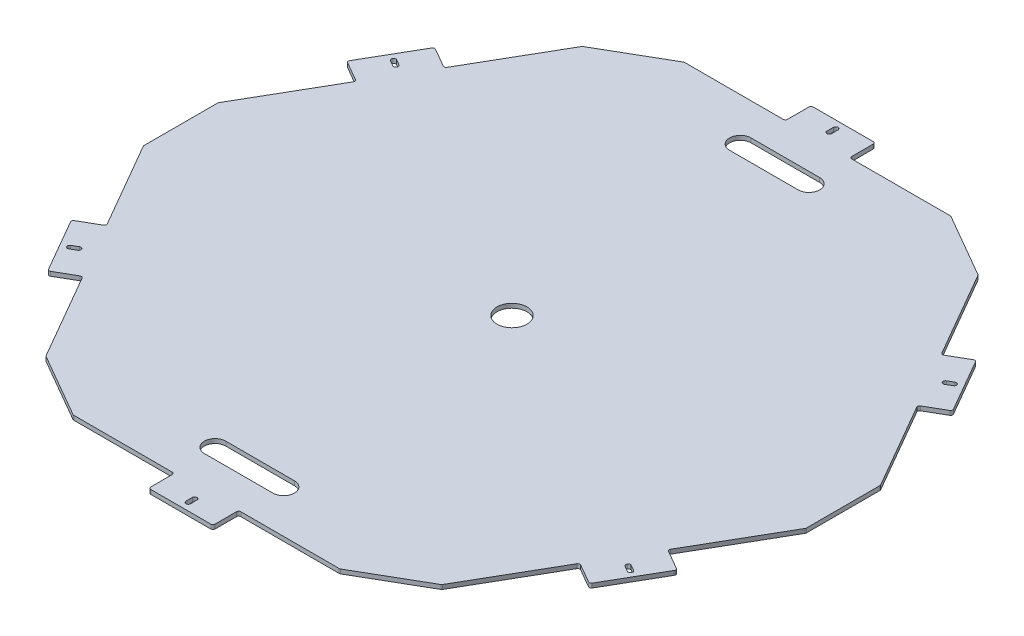
from build123d import *

# Parameters (mm, degrees)
BOSS_EXTRUDE1_DEPTH = 6.35
SKETCH2_R           = 22.225
CUT_EXTRUDE1_DEPTH  = 6.35
FILLET2_R           = 3.175


with BuildPart() as part:
    # Sketch1 → Boss-Extrude1 (new body)
    with BuildSketch(Plane(origin=(0, 0, 0), x_dir=(1, 0, 0), z_dir=(0, 1, 0))):
        Polygon((359.098373018, -359.098373018), (490.5375, -131.439126982), (490.5375, 131.439126982), (359.098373018, 359.098373018), (131.439126982, 490.5375), (-131.439126982, 490.5375), (-359.098373018, 359.098373018), (-490.5375, 131.439126982), (-490.5375, -131.439126982), (-359.098373018, -359.098373018), (-131.439126982, -490.5375), (131.439126982, -490.5375), align=None)
    extrude(amount=BOSS_EXTRUDE1_DEPTH)

    # Sketch2 → Cut-Extrude1 (cut)
    with BuildSketch(Plane(origin=(0, 6.35, 0), x_dir=(1, 0, 0), z_dir=(0, 1, 0))):
        Circle(SKETCH2_R)
        Polygon((-131.439126982, 490.5375), (-197.430262751, 452.4375), (-47.625, 452.4375), (-47.625, 490.5375), align=None)
        Polygon((131.439126982, 490.5375), (47.625, 490.5375), (47.625, 452.4375), (197.430262751, 452.4375), align=None)
        with BuildLine():
            Line((3.3734375, 479.425), (3.3734375, 469.9))
            ThreePointArc((3.3734375, 469.9), (0, 466.5265625), (-3.3734375, 469.9))
            Line((-3.3734375, 469.9), (-3.3734375, 479.425))
            ThreePointArc((-3.3734375, 479.425), (0, 482.7984375), (3.3734375, 479.425))
        make_face()
        with BuildLine():
            Line((-50.8, 404.8125), (50.8, 404.8125))
            ThreePointArc((50.8, 404.8125), (66.675, 388.9375), (50.8, 373.0625))
            Line((50.8, 373.0625), (-50.8, 373.0625))
            ThreePointArc((-50.8, 373.0625), (-66.675, 388.9375), (-50.8, 404.8125))
        make_face()
        Polygon((401.005436509, 286.513209855), (359.098373018, 359.098373018), (293.107237249, 397.198373018), (368.009868625, 267.463209855), align=None)
        Polygon((490.5375, 55.239126982), (490.5375, 131.439126982), (448.630436509, 204.024290145), (415.634868625, 184.974290145), align=None)
        Polygon((448.630436509, -204.024290145), (490.5375, -131.439126982), (490.5375, -55.239126982), (415.634868625, -184.974290145), align=None)
        Polygon((293.107237249, -397.198373018), (359.098373018, -359.098373018), (401.005436509, -286.513209855), (368.009868625, -267.463209855), align=None)
        Polygon((47.625, -490.5375), (131.439126982, -490.5375), (197.430262751, -452.4375), (47.625, -452.4375), align=None)
        Polygon((-197.430262751, -452.4375), (-131.439126982, -490.5375), (-47.625, -490.5375), (-47.625, -452.4375), align=None)
        Polygon((-401.005436509, -286.513209855), (-359.098373018, -359.098373018), (-293.107237249, -397.198373018), (-368.009868625, -267.463209855), align=None)
        Polygon((-490.5375, -55.239126982), (-490.5375, -131.439126982), (-448.630436509, -204.024290145), (-415.634868625, -184.974290145), align=None)
        Polygon((-448.630436509, 204.024290145), (-490.5375, 131.439126982), (-490.5375, 55.239126982), (-415.634868625, 184.974290145), align=None)
        Polygon((-293.107237249, 397.198373018), (-359.098373018, 359.098373018), (-401.005436509, 286.513209855), (-368.009868625, 267.463209855), align=None)
        with BuildLine():
            Line((-413.507510459, 242.633982573), (-405.258618488, 237.871482573))
            ThreePointArc((-405.258618488, 237.871482573), (-404.023854665, 233.26328125), (-408.632055988, 232.028517427))
            Line((-408.632055988, 232.028517427), (-416.880947959, 236.791017427))
            ThreePointArc((-416.880947959, 236.791017427), (-418.115711782, 241.39921875), (-413.507510459, 242.633982573))
        make_face()
        with BuildLine():
            Line((416.880947959, 236.791017427), (408.632055988, 232.028517427))
            ThreePointArc((408.632055988, 232.028517427), (404.023854665, 233.26328125), (405.258618488, 237.871482573))
            Line((405.258618488, 237.871482573), (413.507510459, 242.633982573))
            ThreePointArc((413.507510459, 242.633982573), (418.115711782, 241.39921875), (416.880947959, 236.791017427))
        make_face()
        with BuildLine():
            Line((416.880947959, -236.791017427), (408.632055988, -232.028517427))
            ThreePointArc((408.632055988, -232.028517427), (404.023854665, -233.26328125), (405.258618488, -237.871482573))
            Line((405.258618488, -237.871482573), (413.507510459, -242.633982573))
            ThreePointArc((413.507510459, -242.633982573), (418.115711782, -241.39921875), (416.880947959, -236.791017427))
        make_face()
        with BuildLine():
            Line((-50.8, -404.8125), (50.8, -404.8125))
            ThreePointArc((50.8, -404.8125), (66.675, -388.9375), (50.8, -373.0625))
            Line((50.8, -373.0625), (-50.8, -373.0625))
            ThreePointArc((-50.8, -373.0625), (-66.675, -388.9375), (-50.8, -404.8125))
        make_face()
        with BuildLine():
            Line((3.3734375, -479.425), (3.3734375, -469.9))
            ThreePointArc((3.3734375, -469.9), (0, -466.5265625), (-3.3734375, -469.9))
            Line((-3.3734375, -469.9), (-3.3734375, -479.425))
            ThreePointArc((-3.3734375, -479.425), (0, -482.7984375), (3.3734375, -479.425))
        make_face()
        with BuildLine():
            Line((-413.507510459, -242.633982573), (-405.258618488, -237.871482573))
            ThreePointArc((-405.258618488, -237.871482573), (-404.023854665, -233.26328125), (-408.632055988, -232.028517427))
            Line((-408.632055988, -232.028517427), (-416.880947959, -236.791017427))
            ThreePointArc((-416.880947959, -236.791017427), (-418.115711782, -241.39921875), (-413.507510459, -242.633982573))
        make_face()
    extrude(amount=-CUT_EXTRUDE1_DEPTH, mode=Mode.SUBTRACT)

    # Fillet2
    fillet2_edges = [part.edges().sort_by_distance(p)[0] for p in [
        (-47.625, 3.175, 490.5375),
        (47.625, 3.175, 490.5375),
        (47.625, 3.175, 452.4375),
        (197.430262751, 3.175, 452.4375),
        (293.107237249, 3.175, 397.198373018),
        (368.009868625, 3.175, 267.463209855),
        (401.005436509, 3.175, 286.513209855),
        (448.630436509, 3.175, 204.024290145),
        (415.634868625, 3.175, 184.974290145),
        (490.5375, 3.175, 55.239126982),
        (490.5375, 3.175, -55.239126982),
        (415.634868625, 3.175, -184.974290145),
        (448.630436509, 3.175, -204.024290145),
        (401.005436509, 3.175, -286.513209855),
        (368.009868625, 3.175, -267.463209855),
        (293.107237249, 3.175, -397.198373018),
        (197.430262751, 3.175, -452.4375),
        (47.625, 3.175, -452.4375),
        (47.625, 3.175, -490.5375),
        (-47.625, 3.175, -490.5375),
        (-47.625, 3.175, -452.4375),
        (-197.430262751, 3.175, -452.4375),
        (-368.009868625, 3.175, -267.463209855),
        (-401.005436509, 3.175, -286.513209855),
        (-448.630436509, 3.175, -204.024290145),
        (-415.634868625, 3.175, -184.974290145),
        (-490.5375, 3.175, -55.239126982),
        (-490.5375, 3.175, 55.239126982),
        (-415.634868625, 3.175, 184.974290145),
        (-448.630436509, 3.175, 204.024290145),
        (-401.005436509, 3.175, 286.513209855),
        (-368.009868625, 3.175, 267.463209855),
        (-293.107237249, 3.175, 397.198373018),
        (-197.430262751, 3.175, 452.4375),
        (-47.625, 3.175, 452.4375),
        (-293.107237249, 3.175, -397.198373018),
    ]]
    fillet(fillet2_edges, radius=FILLET2_R)


solid = part.part
